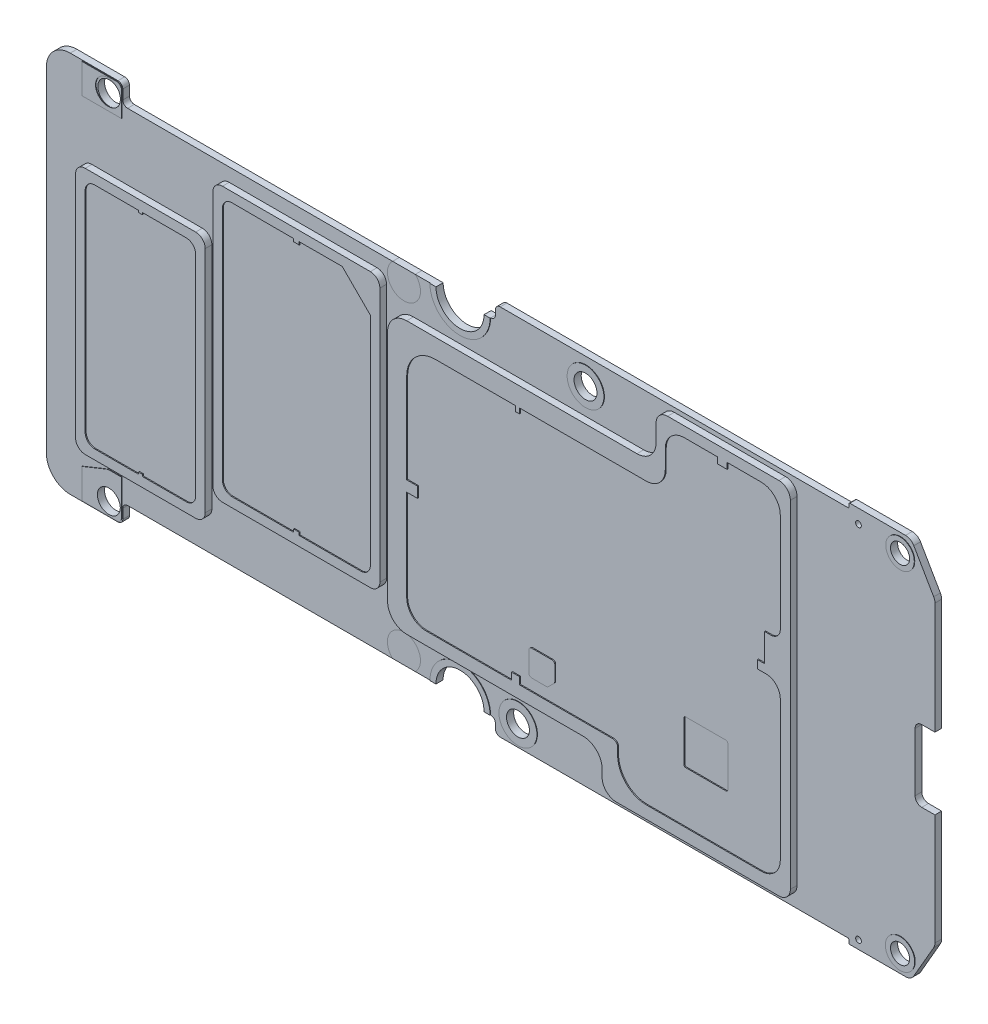
from build123d import *
from build123d.topology import SkipClean

# Parameters (mm, degrees)
SKETCH_1_W           = 93
SKETCH_1_H           = 40
EXTRUDE_1_DEPTH      = 0.7
SKETCH_2_OUTSIDE_W   = 115.248
SKETCH_2_OUTSIDE_H   = 62.248
CUT_EXTRUDE_2_DEPTH  = 0.7
SKETCH_3_R           = 1.3
EXTRUDE_2_DEPTH      = 0.05
SKETCH_4_R           = 1.2
CUT_EXTRUDE_3_DEPTH  = 64.678234347
EXTRUDE_3_DEPTH      = 0.7
CUT_EXTRUDE_4_DEPTH  = 0.7
CUT_EXTRUDE_5_DEPTH  = 0.6
SKETCH_9_R           = 1.73
SKETCH_9_R_2         = 2.515133995
SKETCH_9_R_3         = 2.52
CUT_EXTRUDE_6_DEPTH  = 64.677665076
EXTRUDE_START        = 0.05
EXTRUDE_4_DEPTH      = 0.05
EXTRUDE_5_DEPTH      = 0.7
CUT_EXTRUDE_8_DEPTH  = 0.7
CUT_EXTRUDE_9_DEPTH  = 0.6
CUT_EXTRUDE_10_DEPTH = 64.677665076
SKETCH_17_R          = 1.990840992
SKETCH_17_R_2        = 1.924641939
EXTRUDE_6_DEPTH      = 0.05
SKETCH_18_R          = 1.2
CUT_EXTRUDE_11_DEPTH = 64.678234347
SKETCH_19_R          = 1.492581281
SKETCH_19_R_2        = 1.538517569
SKETCH_19_R_3        = 0.3
EXTRUDE_7_DEPTH      = 0.05
SKETCH_20_R          = 1
SKETCH_20_R_2        = 0.3
CUT_EXTRUDE_12_DEPTH = 64.678234347
CUT_EXTRUDE_13_DEPTH = 0.1
EXTRUDE_8_DEPTH      = 0.1
EXTRUDE_9_DEPTH      = 0.7
EXTRUDE_9_2_DEPTH    = 0.7


with BuildPart() as part:
    # 草图1 → 凸台-拉伸1 (new body)
    with BuildSketch(Plane.XY):
        with Locations((2.346153846, 20.846153846)):
            Rectangle(SKETCH_1_W, SKETCH_1_H)
    extrude(amount=EXTRUDE_1_DEPTH)

    # 草图2 outside → 切除-拉伸2 (cut)
    with BuildSketch(Plane.XY.offset(0.7)):
        with Locations((2.346, 20.846)):
            Rectangle(SKETCH_2_OUTSIDE_W, SKETCH_2_OUTSIDE_H)
        with BuildLine():
            Line((-44.153846154, 38.346153846), (-44.153846154, 3.346153846))
            ThreePointArc((-44.153846154, 3.346153846), (-43.421613107, 1.578386893), (-41.653846154, 0.846153846))
            Line((-41.653846154, 0.846153846), (-38.153846154, 0.846153846))
            Line((-38.153846154, 0.846153846), (-36.653846154, 0.846153846))
            ThreePointArc((-36.653846154, 0.846153846), (-36.300292763, 0.992600456), (-36.153846154, 1.346153846))
            Line((-36.153846154, 1.346153846), (-36.153846154, 2.346153846))
            ThreePointArc((-36.153846154, 2.346153846), (-36.007399544, 2.699707237), (-35.653846154, 2.846153846))
            Line((-35.653846154, 2.846153846), (2.346153846, 2.846153846))
            ThreePointArc((2.346153846, 2.846153846), (2.699707237, 2.699707237), (2.846153846, 2.346153846))
            Line((2.846153846, 2.346153846), (2.846153846, 1.846153846))
            ThreePointArc((2.846153846, 1.846153846), (2.992600456, 1.492600456), (3.346153846, 1.346153846))
            Line((3.346153846, 1.346153846), (39.746153846, 1.346153846))
            ThreePointArc((39.746153846, 1.346153846), (39.816864524, 1.316864524), (39.846153846, 1.246153846))
            Line((39.846153846, 1.246153846), (39.846153846, 0.946153846))
            ThreePointArc((39.846153846, 0.946153846), (39.875443168, 0.875443168), (39.946153846, 0.846153846))
            Line((39.946153846, 0.846153846), (46.346153846, 0.846153846))
            ThreePointArc((46.346153846, 0.846153846), (48.113920799, 1.578386893), (48.846153846, 3.346153846))
            Line((48.846153846, 3.346153846), (48.846153846, 38.346153846))
            ThreePointArc((48.846153846, 38.346153846), (48.113920799, 40.113920799), (46.346153846, 40.846153846))
            Line((46.346153846, 40.846153846), (39.946153846, 40.846153846))
            ThreePointArc((39.946153846, 40.846153846), (39.875443168, 40.816864524), (39.846153846, 40.746153846))
            Line((39.846153846, 40.746153846), (39.846153846, 40.446153846))
            ThreePointArc((39.846153846, 40.446153846), (39.816864524, 40.375443168), (39.746153846, 40.346153846))
            Line((39.746153846, 40.346153846), (3.346153846, 40.346153846))
            ThreePointArc((3.346153846, 40.346153846), (2.992600456, 40.199707237), (2.846153846, 39.846153846))
            Line((2.846153846, 39.846153846), (2.846153846, 39.346153846))
            ThreePointArc((2.846153846, 39.346153846), (2.699707237, 38.992600456), (2.346153846, 38.846153846))
            Line((2.346153846, 38.846153846), (-35.653846154, 38.846153846))
            ThreePointArc((-35.653846154, 38.846153846), (-36.007399544, 38.992600456), (-36.153846154, 39.346153846))
            Line((-36.153846154, 39.346153846), (-36.153846154, 40.346153846))
            ThreePointArc((-36.153846154, 40.346153846), (-36.300292763, 40.699707237), (-36.653846154, 40.846153846))
            Line((-36.653846154, 40.846153846), (-41.653846154, 40.846153846))
            ThreePointArc((-41.653846154, 40.846153846), (-43.421613107, 40.113920799), (-44.153846154, 38.346153846))
        make_face(mode=Mode.SUBTRACT)
    extrude(amount=-CUT_EXTRUDE_2_DEPTH, mode=Mode.SUBTRACT)

    # 草图3 → 凸台-拉伸2 (add)
    # profile 1 of 2: a face of its own
    with BuildSketch(Plane.XY.offset(0.7)):
        with BuildLine():
            Line((-40.392036003, 40.756153846), (-40.392036003, 37.646153846))
            Line((-40.392036003, 37.646153846), (-36.242036003, 37.646153846))
            Line((-36.242036003, 37.646153846), (-36.242036003, 40.256153846))
            ThreePointArc((-36.242036003, 40.256153846), (-36.388482612, 40.609707237), (-36.742036003, 40.756153846))
            Line((-36.742036003, 40.756153846), (-40.392036003, 40.756153846))
        make_face()
        with Locations((-37.653846154, 39.346153846)):
            Circle(SKETCH_3_R, mode=Mode.SUBTRACT)
    # profile 2 of 2: a face of its own
    with BuildSketch(Plane.XY.offset(0.7)):
        with BuildLine():
            Line((-40.392036003, 4.046153846), (-40.392036003, 0.936153846))
            Line((-40.392036003, 0.936153846), (-36.742036003, 0.936153846))
            ThreePointArc((-36.742036003, 0.936153846), (-36.388482612, 1.082600456), (-36.242036003, 1.436153846))
            Line((-36.242036003, 1.436153846), (-36.242036003, 4.046153846))
            Line((-36.242036003, 4.046153846), (-36.242036003, 5.145058359))
            Line((-36.242036003, 5.145058359), (-37.653846154, 5.145058359))
            Line((-37.653846154, 5.145058359), (-40.392036003, 4.046153846))
        make_face()
    extrude(amount=EXTRUDE_2_DEPTH)

    # 草图4 → 切除-拉伸3 (cut, through all)
    with BuildSketch(Plane.XY.offset(0.75)):
        with Locations((-37.565215366, 39.271782245)):
            Circle(SKETCH_4_R)
        with Locations((-37.565215366, 2.297505186)):
            Circle(SKETCH_4_R)
    extrude(amount=-CUT_EXTRUDE_3_DEPTH, mode=Mode.SUBTRACT)

    # 草图6 → 凸台-拉伸3 (add)
    with BuildSketch(Plane.XY.offset(0.7)):
        with BuildLine():
            Line((-39.392036003, 31.889508088), (-27.827332984, 31.889508088))
            ThreePointArc((-27.827332984, 31.889508088), (-27.120226203, 31.59661487), (-26.827332984, 30.889508088))
            Line((-26.827332984, 30.889508088), (-26.827332984, 6.946390186))
            ThreePointArc((-26.827332984, 6.946390186), (-27.120226203, 6.239283405), (-27.827332984, 5.946390186))
            Line((-27.827332984, 5.946390186), (-39.392036003, 5.946390186))
            ThreePointArc((-39.392036003, 5.946390186), (-40.099142784, 6.239283405), (-40.392036003, 6.946390186))
            Line((-40.392036003, 6.946390186), (-40.392036003, 30.889508088))
            ThreePointArc((-40.392036003, 30.889508088), (-40.099142784, 31.59661487), (-39.392036003, 31.889508088))
        make_face()
        with BuildLine():
            Line((-25.026001157, 37.448747639), (-9.546950678, 37.448747639))
            ThreePointArc((-9.546950678, 37.448747639), (-8.839843897, 37.15585442), (-8.546950678, 36.448747639))
            Line((-8.546950678, 36.448747639), (-8.546950678, 9.80113482))
            ThreePointArc((-8.546950678, 9.80113482), (-8.839843897, 9.094028039), (-9.546950678, 8.80113482))
            Line((-9.546950678, 8.80113482), (-25.026001157, 8.80113482))
            ThreePointArc((-25.026001157, 8.80113482), (-25.733107938, 9.094028039), (-26.026001157, 9.80113482))
            Line((-26.026001157, 9.80113482), (-26.026001157, 36.448747639))
            ThreePointArc((-26.026001157, 36.448747639), (-25.733107938, 37.15585442), (-25.026001157, 37.448747639))
        make_face()
    extrude(amount=EXTRUDE_3_DEPTH)

    # 草图7 → 切除-拉伸4 (cut)
    with BuildSketch(Plane.XY.offset(1.4)):
        with BuildLine():
            Line((-33.809684494, 30.67442357), (-33.809684494, 30.87442357))
            Line((-33.809684494, 30.87442357), (-38.392036003, 30.87442357))
            ThreePointArc((-38.392036003, 30.87442357), (-39.099142784, 30.581530352), (-39.392036003, 29.87442357))
            Line((-39.392036003, 29.87442357), (-39.392036003, 7.946390186))
            ThreePointArc((-39.392036003, 7.946390186), (-39.099142784, 7.239283405), (-38.392036003, 6.946390186))
            Line((-38.392036003, 6.946390186), (-33.809684494, 6.946390186))
            Line((-33.809684494, 6.946390186), (-33.809684494, 7.146390186))
            Line((-33.809684494, 7.146390186), (-33.409684494, 7.146390186))
            Line((-33.409684494, 7.146390186), (-33.409684494, 6.946390186))
            Line((-33.409684494, 6.946390186), (-28.827332984, 6.946390186))
            ThreePointArc((-28.827332984, 6.946390186), (-28.120226203, 7.239283405), (-27.827332984, 7.946390186))
            Line((-27.827332984, 7.946390186), (-27.827332984, 29.87442357))
            ThreePointArc((-27.827332984, 29.87442357), (-28.120226203, 30.581530352), (-28.827332984, 30.87442357))
            Line((-28.827332984, 30.87442357), (-33.409684494, 30.87442357))
            Line((-33.409684494, 30.87442357), (-33.409684494, 30.67442357))
            Line((-33.409684494, 30.67442357), (-33.809684494, 30.67442357))
        make_face()
        with BuildLine():
            Line((-12.487226043, 36.443050036), (-16.986475355, 36.434331488))
            Line((-16.986475355, 36.434331488), (-16.986475355, 36.13316882))
            Line((-16.986475355, 36.13316882), (-17.586475355, 36.13316882))
            Line((-17.586475355, 36.13316882), (-17.586475355, 36.43316882))
            Line((-17.586475355, 36.43316882), (-19.8680475, 36.428747639))
            Line((-19.8680475, 36.428747639), (-24.02212368, 36.444855097))
            ThreePointArc((-24.02212368, 36.444855097), (-24.731735711, 36.153338965), (-25.026001157, 35.444862615))
            Line((-25.026001157, 35.444862615), (-25.026001157, 10.80113482))
            ThreePointArc((-25.026001157, 10.80113482), (-24.733107938, 10.094028039), (-24.026001157, 9.80113482))
            Line((-24.026001157, 9.80113482), (-17.586475355, 9.80113482))
            Line((-17.586475355, 9.80113482), (-17.586475355, 10.101049215))
            Line((-17.586475355, 10.101049215), (-16.986475355, 10.101049215))
            Line((-16.986475355, 10.101049215), (-16.986475355, 9.80113482))
            Line((-16.986475355, 9.80113482), (-10.546950678, 9.80113482))
            ThreePointArc((-10.546950678, 9.80113482), (-9.839843897, 10.094028039), (-9.546950678, 10.80113482))
            Line((-9.546950678, 10.80113482), (-9.546950678, 33.502774672))
            Line((-9.546950678, 33.502774672), (-12.487226043, 36.443050036))
        make_face()
    extrude(amount=-CUT_EXTRUDE_4_DEPTH, mode=Mode.SUBTRACT)

    # 草图8 → 切除-拉伸5 (cut)
    with BuildSketch(Plane.XY.offset(0.7)):
        with BuildLine():
            Line((-39.099142784, 31.59661487), (-28.023772583, 31.59661487))
            ThreePointArc((-28.023772583, 31.59661487), (-27.316665802, 31.303721651), (-27.023772583, 30.59661487))
            Line((-27.023772583, 30.59661487), (-27.023772583, 7.182815902))
            ThreePointArc((-27.023772583, 7.182815902), (-27.316665802, 6.475709121), (-28.023772583, 6.182815902))
            Line((-28.023772583, 6.182815902), (-39.099142784, 6.182815902))
            ThreePointArc((-39.099142784, 6.182815902), (-39.806249565, 6.475709121), (-40.099142784, 7.182815902))
            Line((-40.099142784, 7.182815902), (-40.099142784, 30.59661487))
            ThreePointArc((-40.099142784, 30.59661487), (-39.806249565, 31.303721651), (-39.099142784, 31.59661487))
        make_face()
        with BuildLine():
            Line((-24.733107938, 37.23698434), (-9.84135766, 37.23698434))
            ThreePointArc((-9.84135766, 37.23698434), (-9.134250879, 36.944091121), (-8.84135766, 36.23698434))
            Line((-8.84135766, 36.23698434), (-8.84135766, 10.094028039))
            ThreePointArc((-8.84135766, 10.094028039), (-9.134250879, 9.386921258), (-9.84135766, 9.094028039))
            Line((-9.84135766, 9.094028039), (-24.733107938, 9.094028039))
            ThreePointArc((-24.733107938, 9.094028039), (-25.440214719, 9.386921258), (-25.733107938, 10.094028039))
            Line((-25.733107938, 10.094028039), (-25.733107938, 36.23698434))
            ThreePointArc((-25.733107938, 36.23698434), (-25.440214719, 36.944091121), (-24.733107938, 37.23698434))
        make_face()
    extrude(amount=CUT_EXTRUDE_5_DEPTH, mode=Mode.SUBTRACT)

    # 草图9 → 切除-拉伸6 (cut, through all)
    with BuildSketch(Plane.XY.offset(0.7)):
        with Locations((-6.72764939, 37.583478152)):
            Circle(SKETCH_9_R)
        with Locations((-6.72764939, 4.099512186)):
            Circle(SKETCH_9_R)
        with Locations((-0.811258321, 38.846153846)):
            Circle(SKETCH_9_R_2)
        with Locations((-0.811258321, 2.846153846)):
            Circle(SKETCH_9_R_3)
    extrude(amount=-CUT_EXTRUDE_6_DEPTH, mode=Mode.SUBTRACT)

    # 草图11 → 凸台-拉伸4 (add)
    with SkipClean():  # the faces are left unmerged after this step: merging them gives an invalid solid
        with BuildSketch(Plane.XY.offset(0.7).offset(EXTRUDE_START)):
            with BuildLine():
                Line((-3.96123905, 2.846153846), (-3.331258321, 2.846153846))
                ThreePointArc((-3.331258321, 2.846153846), (-0.811258321, 5.366153846), (1.708741679, 2.846153846))
                Line((1.708741679, 2.846153846), (2.338722409, 2.846153846))
                ThreePointArc((2.338722409, 2.846153846), (-0.811258321, 5.996134576), (-3.96123905, 2.846153846))
            make_face()
            with BuildLine():
                Line((-3.326392316, 38.846153846), (-3.96123905, 38.846153846))
                ThreePointArc((-3.96123905, 38.846153846), (-0.811258321, 35.696173117), (2.338722409, 38.846153846))
                Line((2.338722409, 38.846153846), (1.703875674, 38.846153846))
                ThreePointArc((1.703875674, 38.846153846), (-0.811258321, 36.331019851), (-3.326392316, 38.846153846))
            make_face()
        extrude(amount=-EXTRUDE_4_DEPTH)
    add(part.part.scale(1), mode=Mode.REPLACE)  # the faces are merged on a copy

    # 草图12 → 凸台-拉伸5 (add)
    with BuildSketch(Plane.XY.offset(0.7)):
        with BuildLine():
            Line((-5.740204215, 34.894680262), (18.361223146, 34.894680262))
            ThreePointArc((18.361223146, 34.894680262), (19.775436709, 35.480466699), (20.361223146, 36.894680262))
            Line((20.361223146, 36.894680262), (20.361223146, 38.694680262))
            ThreePointArc((20.361223146, 38.694680262), (20.712695009, 39.543208399), (21.561223146, 39.894680262))
            Line((21.561223146, 39.894680262), (33.211936827, 39.894680262))
            ThreePointArc((33.211936827, 39.894680262), (34.060464964, 39.543208399), (34.411936827, 38.694680262))
            Line((34.411936827, 38.694680262), (34.411936827, 3.437998694))
            ThreePointArc((34.411936827, 3.437998694), (34.060464964, 2.589470556), (33.211936827, 2.237998694))
            Line((33.211936827, 2.237998694), (16.21527427, 2.237998694))
            ThreePointArc((16.21527427, 2.237998694), (15.154614098, 2.677338522), (14.71527427, 3.737998694))
            Line((14.71527427, 3.737998694), (14.71527427, 4.472460351))
            ThreePointArc((14.71527427, 4.472460351), (14.129487832, 5.886673913), (12.71527427, 6.472460351))
            Line((12.71527427, 6.472460351), (-5.740204215, 6.472460351))
            ThreePointArc((-5.740204215, 6.472460351), (-7.154417777, 7.058246788), (-7.740204215, 8.472460351))
            Line((-7.740204215, 8.472460351), (-7.740204215, 32.894680262))
            ThreePointArc((-7.740204215, 32.894680262), (-7.154417777, 34.308893824), (-5.740204215, 34.894680262))
        make_face()
    extrude(amount=EXTRUDE_5_DEPTH)

    # 草图14 → 切除-拉伸8 (cut)
    with BuildSketch(Plane.XY.offset(1.4)):
        with BuildLine():
            Line((-2.740204215, 32.894680262), (5.648082761, 32.894680262))
            Line((5.648082761, 32.894680262), (5.648082761, 32.352621529))
            Line((5.648082761, 32.352621529), (6.047006574, 32.352621529))
            Line((6.047006574, 32.352621529), (6.047006574, 32.894680262))
            Line((6.047006574, 32.894680262), (19.319841722, 32.894680262))
            ThreePointArc((19.319841722, 32.894680262), (20.734055285, 33.480466699), (21.319841722, 34.894680262))
            Line((21.319841722, 34.894680262), (21.319841722, 36.823325484))
            ThreePointArc((21.319841722, 36.823325484), (21.90562816, 38.237539047), (23.319841722, 38.823325484))
            Line((23.319841722, 38.823325484), (26.782813094, 38.823325484))
            Line((26.782813094, 38.823325484), (26.782813094, 38.1868628))
            Line((26.782813094, 38.1868628), (27.790545678, 38.1868628))
            Line((27.790545678, 38.1868628), (27.790545678, 38.823325484))
            Line((27.790545678, 38.823325484), (31.359594164, 38.823325484))
            ThreePointArc((31.359594164, 38.823325484), (32.773807726, 38.237539047), (33.359594164, 36.823325484))
            Line((33.359594164, 36.823325484), (33.359594164, 26.457609117))
            ThreePointArc((33.359594164, 26.457609117), (33.066700945, 25.750502336), (32.359594164, 25.457609117))
            Line((32.359594164, 25.457609117), (31.715398896, 25.457609117))
            Line((31.715398896, 25.457609117), (31.715398896, 22.540488482))
            Line((31.715398896, 22.540488482), (30.972859098, 22.540488482))
            Line((30.972859098, 22.540488482), (30.972859098, 21.69187157))
            Line((30.972859098, 21.69187157), (31.715398896, 21.69187157))
            Line((31.715398896, 21.69187157), (31.859594164, 21.69187157))
            ThreePointArc((31.859594164, 21.69187157), (32.920254335, 21.252531741), (33.359594164, 20.19187157))
            Line((33.359594164, 20.19187157), (33.359594164, 5.552685072))
            ThreePointArc((33.359594164, 5.552685072), (32.773807726, 4.138471509), (31.359594164, 3.552685072))
            Line((31.359594164, 3.552685072), (19.334217363, 3.552685072))
            ThreePointArc((19.334217363, 3.552685072), (17.21289702, 4.431364728), (16.334217363, 6.552685072))
            Line((16.334217363, 6.552685072), (16.334217363, 7.295769633))
            ThreePointArc((16.334217363, 7.295769633), (16.187770754, 7.649323023), (15.834217363, 7.795769633))
            Line((15.834217363, 7.795769633), (6.047006574, 7.795769633))
            Line((6.047006574, 7.795769633), (6.047006574, 8.538309431))
            Line((6.047006574, 8.538309431), (5.249158948, 8.538309431))
            Line((5.249158948, 8.538309431), (5.249158948, 7.795769633))
            Line((5.249158948, 7.795769633), (-3.740204215, 7.795769633))
            ThreePointArc((-3.740204215, 7.795769633), (-5.154417777, 8.38155607), (-5.740204215, 9.795769633))
            Line((-5.740204215, 9.795769633), (-5.740204215, 19.358175061))
            Line((-5.740204215, 19.358175061), (-4.616012656, 19.358175061))
            Line((-4.616012656, 19.358175061), (-4.616012656, 20.471984758))
            Line((-4.616012656, 20.471984758), (-5.740204215, 20.471984758))
            Line((-5.740204215, 20.471984758), (-5.740204215, 29.894680262))
            ThreePointArc((-5.740204215, 29.894680262), (-4.861524559, 32.016000605), (-2.740204215, 32.894680262))
        make_face()
    extrude(amount=-CUT_EXTRUDE_8_DEPTH, mode=Mode.SUBTRACT)

    # 草图15 → 切除-拉伸9 (cut)
    with BuildSketch(Plane.XY.offset(0.7)):
        with BuildLine():
            Line((-6.154417777, 34.308893824), (19.711620906, 34.308893824))
            ThreePointArc((19.711620906, 34.308893824), (20.418727687, 34.601787043), (20.711620906, 35.308893824))
            Line((20.711620906, 35.308893824), (20.711620906, 38.483130726))
            ThreePointArc((20.711620906, 38.483130726), (21.004514125, 39.190237508), (21.711620906, 39.483130726))
            Line((21.711620906, 39.483130726), (33.158157524, 39.483130726))
            ThreePointArc((33.158157524, 39.483130726), (33.865264305, 39.190237508), (34.158157524, 38.483130726))
            Line((34.158157524, 38.483130726), (34.158157524, 3.758207859))
            ThreePointArc((34.158157524, 3.758207859), (33.865264305, 3.051101078), (33.158157524, 2.758207859))
            Line((33.158157524, 2.758207859), (16.115052289, 2.758207859))
            ThreePointArc((16.115052289, 2.758207859), (15.407945507, 3.051101078), (15.115052289, 3.758207859))
            Line((15.115052289, 3.758207859), (15.115052289, 5.697728297))
            ThreePointArc((15.115052289, 5.697728297), (14.829229496, 6.397693237), (14.135150455, 6.697526309))
            Line((14.135150455, 6.697526309), (-6.174515944, 7.105795827))
            ThreePointArc((-6.174515944, 7.105795827), (-6.868594984, 7.405628899), (-7.154417777, 8.105593838))
            Line((-7.154417777, 8.105593838), (-7.154417777, 33.308893824))
            ThreePointArc((-7.154417777, 33.308893824), (-6.861524559, 34.016000605), (-6.154417777, 34.308893824))
        make_face()
    extrude(amount=CUT_EXTRUDE_9_DEPTH, mode=Mode.SUBTRACT)

    # 草图16 → 切除-拉伸10 (cut, through all)
    with BuildSketch(Plane.XY.offset(0.7)):
        with BuildLine():
            Line((48.846153846, 20.846153846), (48.846153846, 24.546153846))
            Line((48.846153846, 24.546153846), (47.464828558, 24.546153846))
            ThreePointArc((47.464828558, 24.546153846), (46.969853811, 24.341128593), (46.764828558, 23.846153846))
            Line((46.764828558, 23.846153846), (46.764828558, 17.746153846))
            ThreePointArc((46.764828558, 17.746153846), (46.969853811, 17.251179099), (47.464828558, 17.046153846))
            Line((47.464828558, 17.046153846), (48.846153846, 17.046153846))
            Line((48.846153846, 17.046153846), (48.846153846, 20.846153846))
        make_face()
    extrude(amount=-CUT_EXTRUDE_10_DEPTH, mode=Mode.SUBTRACT)

    # 草图17 → 凸台-拉伸6 (add)
    with BuildSketch(Plane.XY.offset(0.7)):
        with Locations((5.251787956, 3.547085397)):
            Circle(SKETCH_17_R)
        with Locations((12.325070725, 37.654380841)):
            Circle(SKETCH_17_R_2)
    extrude(amount=EXTRUDE_6_DEPTH)

    # 草图18 → 切除-拉伸11 (cut, through all)
    with BuildSketch(Plane.XY.offset(0.75)):
        with Locations((12.325070725, 37.654380841)):
            Circle(SKETCH_18_R)
        with Locations((5.251787956, 3.547085397)):
            Circle(SKETCH_18_R)
        with BuildLine():
            Line((48.846153846, 36.248077635), (48.846153846, 40.846153846))
            Line((48.846153846, 40.846153846), (45.977528249, 40.846153846))
            Line((45.977528249, 40.846153846), (45.768803577, 40.846153846))
            ThreePointArc((45.768803577, 40.846153846), (46.268803577, 40.71217925), (46.634828981, 40.346153846))
            Line((46.634828981, 40.346153846), (48.71217925, 36.748077635))
            ThreePointArc((48.71217925, 36.748077635), (48.812079672, 36.50689668), (48.846153846, 36.248077635))
        make_face()
        with BuildLine():
            Line((46.634828981, 1.346153846), (48.71217925, 4.944230058))
            ThreePointArc((48.71217925, 4.944230058), (48.812079672, 5.185411012), (48.846153846, 5.444230058))
            Line((48.846153846, 5.444230058), (48.846153846, 0.846153846))
            Line((48.846153846, 0.846153846), (45.768803577, 0.846153846))
            ThreePointArc((45.768803577, 0.846153846), (46.268803577, 0.980128442), (46.634828981, 1.346153846))
        make_face()
    extrude(amount=-CUT_EXTRUDE_11_DEPTH, mode=Mode.SUBTRACT)

    # 草图19 → 凸台-拉伸7 (add)
    with BuildSketch(Plane.XY.offset(0.7)):
        with Locations((45.241715813, 38.985216377)):
            Circle(SKETCH_19_R)
        with Locations((45.241715813, 2.711308515)):
            Circle(SKETCH_19_R_2)
        with Locations((40.843310437, 39.399183942)):
            Circle(SKETCH_19_R_3)
        with Locations((40.843310437, 1.728135549)):
            Circle(SKETCH_19_R_3)
    extrude(amount=EXTRUDE_7_DEPTH)

    # 草图20 → 切除-拉伸12 (cut, through all)
    with BuildSketch(Plane.XY.offset(0.75)):
        with Locations((45.241715813, 38.985216377)):
            Circle(SKETCH_20_R)
        with Locations((45.241715813, 2.711308515)):
            Circle(SKETCH_20_R)
        with Locations((40.843310437, 39.399183942)):
            Circle(SKETCH_20_R_2)
        with Locations((40.843310437, 1.728135549)):
            Circle(SKETCH_20_R_2)
    extrude(amount=-CUT_EXTRUDE_12_DEPTH, mode=Mode.SUBTRACT)

    # 草图21 → 切除-拉伸13 (cut)
    with BuildSketch(Plane.XY.offset(0.7)):
        with BuildLine():
            Line((22.768955662, 12.887664411), (26.968955662, 12.887664411))
            ThreePointArc((26.968955662, 12.887664411), (27.110377018, 12.829085767), (27.168955662, 12.687664411))
            Line((27.168955662, 12.687664411), (27.168955662, 8.487664411))
            ThreePointArc((27.168955662, 8.487664411), (27.110377018, 8.346243055), (26.968955662, 8.287664411))
            Line((26.968955662, 8.287664411), (22.768955662, 8.287664411))
            ThreePointArc((22.768955662, 8.287664411), (22.627534305, 8.346243055), (22.568955662, 8.487664411))
            Line((22.568955662, 8.487664411), (22.568955662, 12.687664411))
            ThreePointArc((22.568955662, 12.687664411), (22.627534305, 12.829085767), (22.768955662, 12.887664411))
        make_face()
    extrude(amount=-CUT_EXTRUDE_13_DEPTH, mode=Mode.SUBTRACT)

    # 草图22 → 凸台-拉伸8 (add)
    with BuildSketch(Plane.XY.offset(0.7)):
        with BuildLine():
            Line((6.452287931, 10.86014936), (6.452287931, 8.753336756))
            ThreePointArc((6.452287931, 8.753336756), (6.540155897, 8.541204721), (6.752287931, 8.453336756))
            Line((6.752287931, 8.453336756), (8.269861526, 8.453336756))
            ThreePointArc((8.269861526, 8.453336756), (8.384666556, 8.476172896), (8.481993561, 8.541204721))
            Line((8.481993561, 8.541204721), (9.070777033, 9.129988194))
            ThreePointArc((9.070777033, 9.129988194), (9.135808858, 9.227315198), (9.158644999, 9.342120228))
            Line((9.158644999, 9.342120228), (9.158644999, 10.86014936))
            ThreePointArc((9.158644999, 10.86014936), (9.070777033, 11.072281395), (8.858644999, 11.16014936))
            Line((8.858644999, 11.16014936), (6.752287931, 11.16014936))
            ThreePointArc((6.752287931, 11.16014936), (6.540155897, 11.072281395), (6.452287931, 10.86014936))
        make_face()
    extrude(amount=EXTRUDE_8_DEPTH)


with BuildPart() as body_2:
    # 草图23 → 凸台-拉伸9 (new body)
    with BuildSketch(Plane.XY.offset(0.7)):
        with BuildLine():
            Line((-7.91025249, 38.846153846), (-5.545046291, 38.846153846))
            ThreePointArc((-5.545046291, 38.846153846), (-6.72764939, 35.853478152), (-7.91025249, 38.846153846))
        make_face()
    extrude(amount=-EXTRUDE_9_DEPTH)


with BuildPart() as body_3:
    # 草图23 → Extrude 9 2 (new body)
    with BuildSketch(Plane.XY.offset(0.7)):
        with BuildLine():
            Line((-7.920122816, 2.846153846), (-5.535175964, 2.846153846))
            ThreePointArc((-5.535175964, 2.846153846), (-6.72764939, 5.829512186), (-7.920122816, 2.846153846))
        make_face()
    extrude(amount=-EXTRUDE_9_2_DEPTH)


solid = Compound([part.part, body_2.part, body_3.part])
